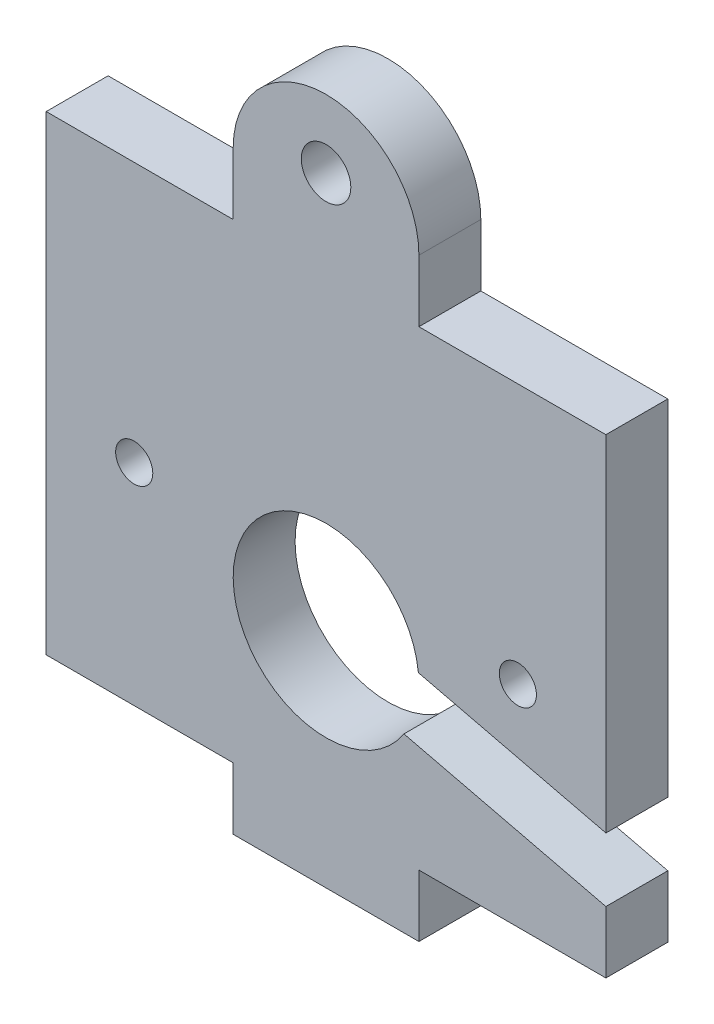
from build123d import *

# Parameters (mm, degrees)
BOSS_EXTRUDE1_DEPTH = 5
SKETCH3_OUTSIDE_W   = 58.75
SKETCH3_OUTSIDE_H   = 49.15
CUT_EXTRUDE2_DEPTH  = 10
SKETCH4_W           = 15
SKETCH4_H           = 5
BOSS_EXTRUDE2_DEPTH = 5
SKETCH5_R           = 1.5
CUT_EXTRUDE4_DEPTH  = 5
SKETCH9_R           = 1.5
SKETCH9_R_2         = 1.569870004
BOSS_EXTRUDE5_DEPTH = 5
SKETCH10_R          = 2
BOSS_EXTRUDE7_DEPTH = 5


with BuildPart() as part:
    # Sketch1 → Boss-Extrude1 (new body)
    with BuildSketch(Plane.XY):
        with BuildLine():
            Line((22.6, -13), (-22.6, -13))
            Line((-22.6, -13), (-22.6, 0))
            ThreePointArc((-22.6, 0), (0, 22.6), (22.6, 0))
            Line((22.6, 0), (22.6, -13))
        make_face()
    extrude(amount=BOSS_EXTRUDE1_DEPTH)

    # Sketch3 outside → Cut-Extrude2 (cut)
    with BuildSketch(Plane.XY.offset(5)):
        with Locations((0, 4.8)):
            Rectangle(SKETCH3_OUTSIDE_W, SKETCH3_OUTSIDE_H)
        with BuildLine():
            Line((22.6, -8), (6.29155051, -4.082449287))
            ThreePointArc((6.29155051, -4.082449287), (-7.292547135, 1.751786597), (7.459408241, 0.779248803))
            Line((7.459408241, 0.779248803), (22.6, -2.857763782))
            Line((22.6, -2.857763782), (22.6, 0))
            ThreePointArc((22.6, 0), (0, 22.6), (-22.6, 0))
            Line((-22.6, 0), (-22.6, -13))
            Line((-22.6, -13), (22.6, -13))
            Line((22.6, -13), (22.6, -8))
        make_face(mode=Mode.SUBTRACT)
    extrude(amount=-CUT_EXTRUDE2_DEPTH, mode=Mode.SUBTRACT)

    # Sketch4 → Boss-Extrude2 (add)
    with BuildSketch(Plane.XY.offset(5)):
        with Locations((0, -15.5)):
            Rectangle(SKETCH4_W, SKETCH4_H)
    extrude(amount=-BOSS_EXTRUDE2_DEPTH)

    # Sketch5 → Cut-Extrude4 (cut)
    with BuildSketch(Plane.XY.offset(5)):
        with Locations((-15.491933385, 4)):
            Circle(SKETCH5_R)
        with Locations((15.491933385, 4)):
            Circle(SKETCH5_R)
    extrude(amount=-CUT_EXTRUDE4_DEPTH, mode=Mode.SUBTRACT)

    # Sketch9 → Boss-Extrude5 (add)
    with BuildSketch(Plane.XY.offset(5)):
        with BuildLine():
            Line((-22.6, 0), (-7.5, 0))
            ThreePointArc((-7.5, 0), (-0.390152659, 7.489845186), (7.459408241, 0.779248803))
            Line((7.459408241, 0.779248803), (10.703358524, 0))
            Line((10.703358524, 0), (22.6, 0))
            Line((22.6, 0), (22.6, 25))
            Line((22.6, 25), (7.5, 25))
            Line((7.5, 25), (7.5, 30))
            Line((7.5, 30), (-7.5, 30))
            Line((-7.5, 30), (-7.5, 25))
            Line((-7.5, 25), (-22.6, 25))
            Line((-22.6, 25), (-22.6, 0))
        make_face()
        with Locations((-15.491933385, 4)):
            Circle(SKETCH9_R, mode=Mode.SUBTRACT)
        with Locations((15.491933385, 4)):
            Circle(SKETCH9_R_2, mode=Mode.SUBTRACT)
    extrude(amount=-BOSS_EXTRUDE5_DEPTH)

    # Sketch10 → Boss-Extrude7 (add)
    with BuildSketch(Plane.XY.offset(5)):
        with BuildLine():
            Line((-7.5, 30), (-7.5, 25))
            Line((-7.5, 25), (7.5, 25))
            Line((7.5, 25), (7.5, 30))
            ThreePointArc((7.5, 30), (0, 37.5), (-7.5, 30))
        make_face()
        with Locations((0, 32)):
            Circle(SKETCH10_R, mode=Mode.SUBTRACT)
    extrude(amount=-BOSS_EXTRUDE7_DEPTH)


solid = part.part
